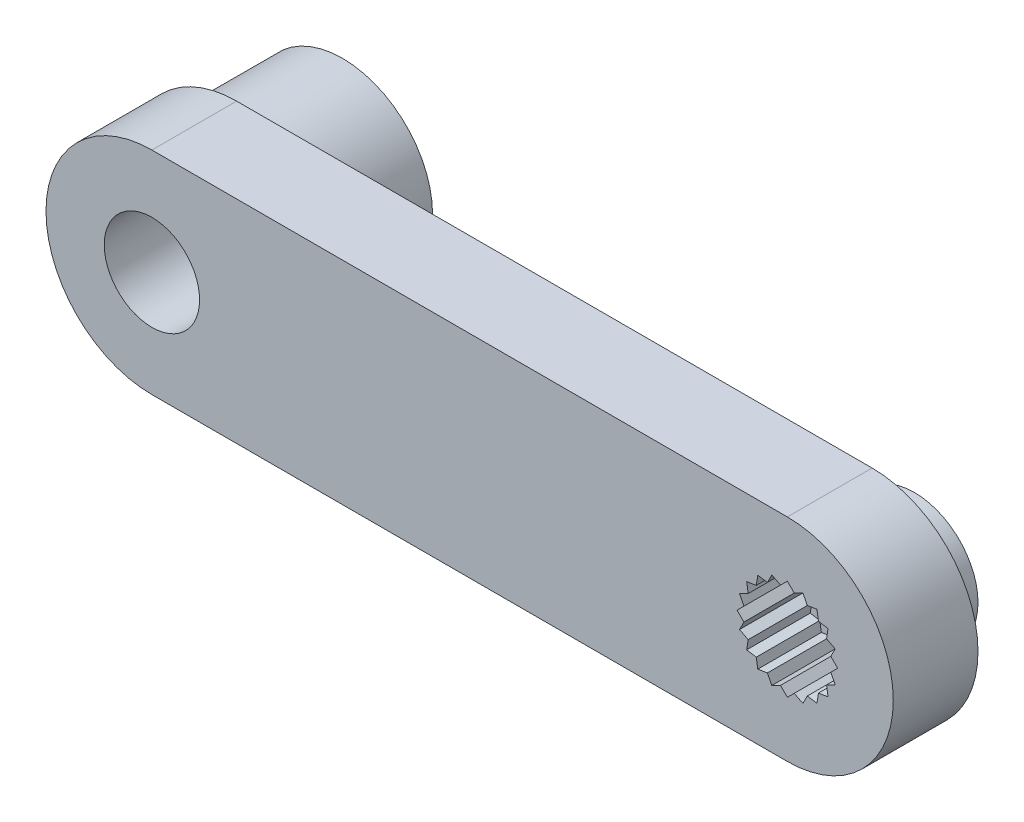
from build123d import *
from build123d.topology import SkipClean

# Parameters (mm, degrees)
SKETCH1_R           = 2.25
SKETCH1_R_2         = 1
BOSS_EXTRUDE1_DEPTH = 2
BOSS_EXTRUDE2_START = 2
SKETCH3_R           = 3
SKETCH3_R_2         = 1
BOSS_EXTRUDE2_DEPTH = 2
BOSS_EXTRUDE3_START = 5
SKETCH4_R           = 4.25
SKETCH4_R_2         = 2.25
BOSS_EXTRUDE3_DEPTH = 5
CUT_EXTRUDE1_DEPTH  = 3


with BuildPart() as part:
    # Sketch1 → Boss-Extrude1 (new, symmetric)
    with BuildSketch(Plane.XY):
        with BuildLine():
            Line((0, 5), (30, 5))
            ThreePointArc((30, 5), (35, 0), (30, -5))
            Line((30, -5), (0, -5))
            ThreePointArc((0, -5), (-5, 0), (0, 5))
        make_face()
        Circle(SKETCH1_R, mode=Mode.SUBTRACT)
        with Locations((30, 0)):
            Circle(SKETCH1_R_2, mode=Mode.SUBTRACT)
    extrude(amount=BOSS_EXTRUDE1_DEPTH, both=True)

    # Sketch3 → Boss-Extrude2 (add)
    with SkipClean():  # the faces are left unmerged after this step: merging them gives an invalid solid
        with BuildSketch(Plane(origin=(0, 0, -2), x_dir=(-1, 0, 0), z_dir=(0, 0, -1)).offset(BOSS_EXTRUDE2_START)):
            with Locations((-30, 0)):
                Circle(SKETCH3_R)
            with Locations((-30, 0)):
                Circle(SKETCH3_R_2, mode=Mode.SUBTRACT)
        extrude(amount=-BOSS_EXTRUDE2_DEPTH)

    # Sketch4 → Boss-Extrude3 (add)
    with SkipClean():  # the faces are left unmerged after this step: merging them gives an invalid solid
        with BuildSketch(Plane(origin=(0, 0, -2), x_dir=(-1, 0, 0), z_dir=(0, 0, -1)).offset(BOSS_EXTRUDE3_START)):
            Circle(SKETCH4_R)
            Circle(SKETCH4_R_2, mode=Mode.SUBTRACT)
        extrude(amount=-BOSS_EXTRUDE3_DEPTH)

    # Sketch6 → Cut-Extrude1 (cut)
    with SkipClean():  # the faces are left unmerged after this step: merging them gives an invalid solid
        with BuildSketch(Plane.XY.offset(2)):
            Polygon((29.675269252, 2.050269252), (30, 2.375), (30.324730748, 2.050269252), (30.733915362, 2.258759226), (30.942405336, 1.849574613), (31.395989974, 1.921415362), (31.467830723, 1.467830723), (31.921415362, 1.395989974), (31.849574613, 0.942405336), (32.258759226, 0.733915362), (32.050269252, 0.324730748), (32.375, 0), (32.050269252, -0.324730748), (32.258759226, -0.733915362), (31.849574613, -0.942405336), (31.921415362, -1.395989974), (31.467830723, -1.467830723), (31.395989974, -1.921415362), (30.942405336, -1.849574613), (30.733915362, -2.258759226), (30.324730748, -2.050269252), (30, -2.375), (29.675269252, -2.050269252), (29.266084638, -2.258759226), (29.057594664, -1.849574613), (28.604010026, -1.921415362), (28.532169277, -1.467830723), (28.078584638, -1.395989974), (28.150425387, -0.942405336), (27.741240774, -0.733915362), (27.949730748, -0.324730748), (27.625, 0), (27.949730748, 0.324730748), (27.741240774, 0.733915362), (28.150425387, 0.942405336), (28.078584638, 1.395989974), (28.532169277, 1.467830723), (28.604010026, 1.921415362), (29.057594664, 1.849574613), (29.266084638, 2.258759226), align=None)
        extrude(amount=-CUT_EXTRUDE1_DEPTH, mode=Mode.SUBTRACT)


solid = part.part
